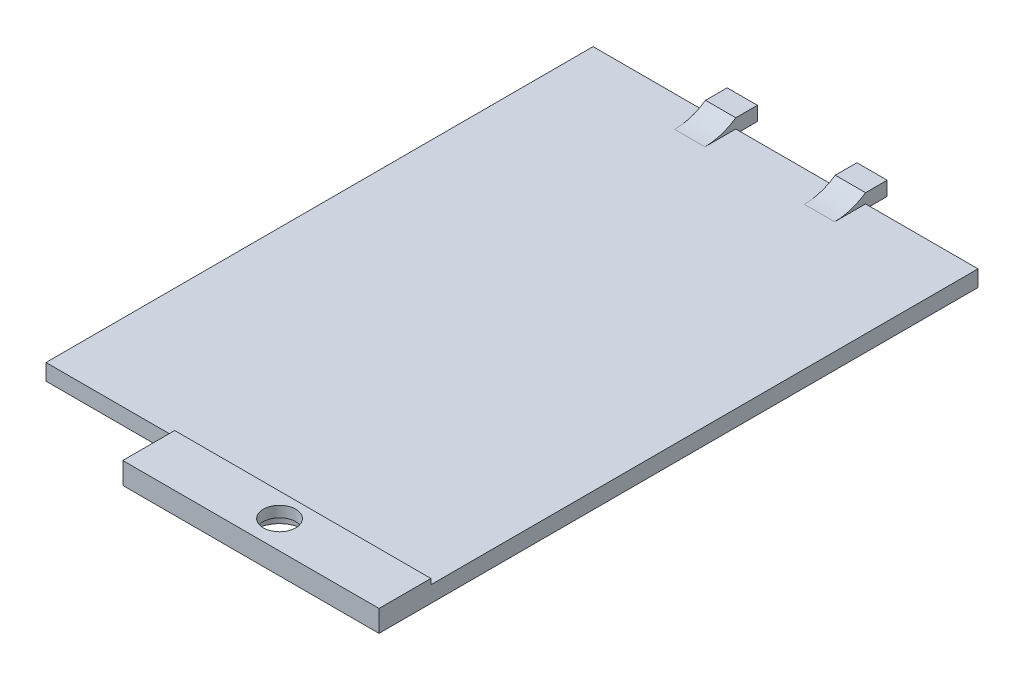
from build123d import *

# Parameters (mm, degrees)
SKETCH_1_W          = 35.6
SKETCH_1_H          = 50.6
EXTRUDE_1_DEPTH     = 1.5
SKETCH_2_W          = 23.7
SKETCH_2_H          = 4.8
SKETCH_2_R          = 1.5
EXTRUDE_2_DEPTH     = 2
SKETCH_2_3_R        = 2.25
CUT_EXTRUDE_1_DEPTH = 1
SKETCH_3_W          = 2.8
SKETCH_3_H          = 1.3
EXTRUDE_3_DEPTH     = 2
FILLET_1_R          = 5


with BuildPart() as part:
    # 草图1 → 凸台-拉伸1 (new body)
    with BuildSketch(Plane(origin=(0, 0, 0), x_dir=(1, 0, 0), z_dir=(0, 1, 0))):
        with Locations((17.8, -25.3)):
            Rectangle(SKETCH_1_W, SKETCH_1_H)
    extrude(amount=EXTRUDE_1_DEPTH)

    # 草图2 → 凸台-拉伸2 (add)
    with BuildSketch(Plane.XZ):
        with Locations((23.75, 53)):
            Rectangle(SKETCH_2_W, SKETCH_2_H)
        with Locations(Location((23.8, 52.8, 0), (0, 0, 270))):
            Circle(SKETCH_2_R, mode=Mode.SUBTRACT)
    extrude(amount=-EXTRUDE_2_DEPTH)

    # 草图2<3> → 切除-拉伸1 (cut)
    with BuildSketch(Plane.XZ):
        with Locations(Location((23.8, 52.8, 0), (0, 0, 270))):
            Circle(SKETCH_2_3_R)
    extrude(amount=-CUT_EXTRUDE_1_DEPTH, mode=Mode.SUBTRACT)

    # 草图3 → 凸台-拉伸3 (add)
    with BuildSketch(Plane(origin=(0, 0, 0), x_dir=(-1, 0, 0), z_dir=(0, 0, -1))):
        with Locations((-23.8, 1.75)):
            Rectangle(SKETCH_3_W, SKETCH_3_H)
        with Locations((-11.8, 1.75)):
            Rectangle(SKETCH_3_W, SKETCH_3_H)
    extrude(amount=EXTRUDE_3_DEPTH)

    # 圆角1
    # the kernel refuses this fillet: 5 mm, written as the material it adds along each edge
    with BuildSketch(Plane(origin=(13.2, 1.5, 0), x_dir=(0, 0, 1), z_dir=(-1, 0, 0)), Plane(origin=(25.2, 1.5, 0), x_dir=(0, 0, 1), z_dir=(-1, 0, 0))) as fillet_1_piece_1:
        with BuildLine():
            CenterArc((2.861817604, 5), FILLET_1_R, 235.084793753, 34.915206247)
            Line((0, 0.9), (0, 0))
            Line((0, 0), (2.861817604, 0))
        make_face()
    extrude(amount=2.8)


solid = part.part
